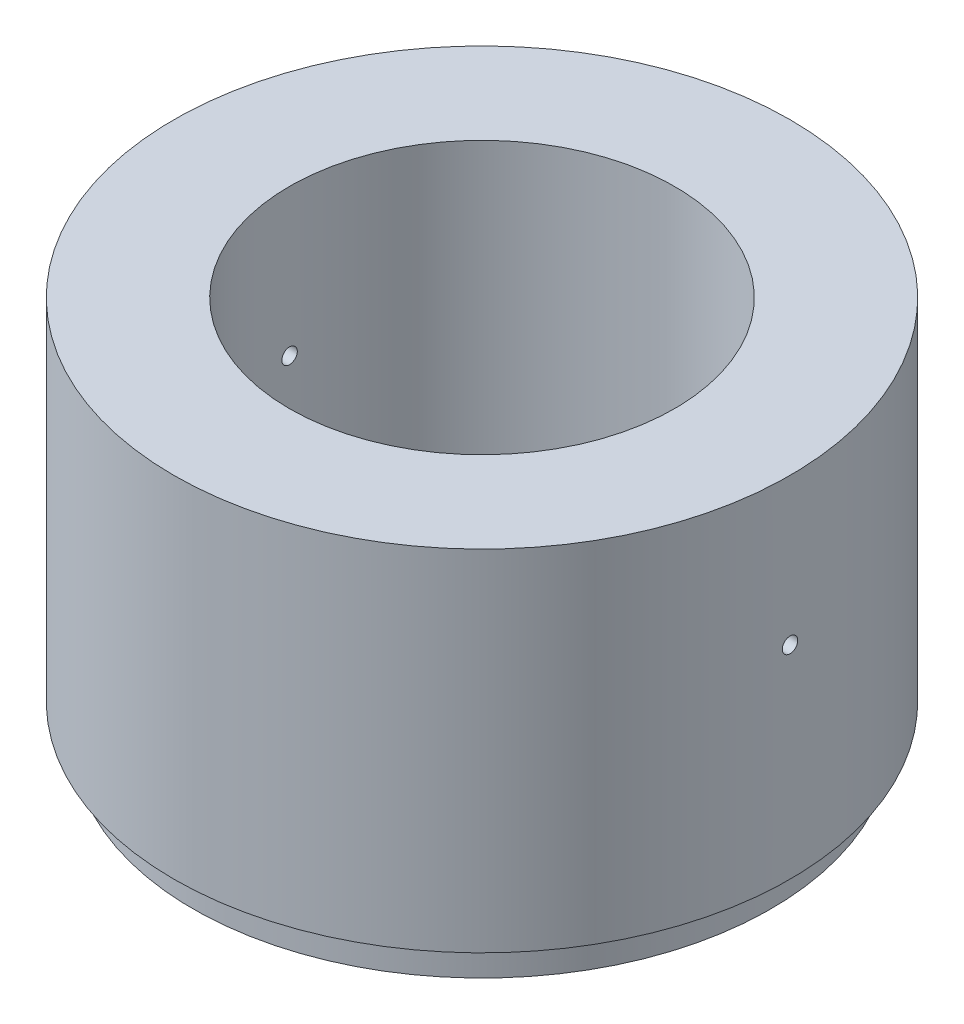
from build123d import *

# Parameters (mm, degrees)
SKETCH1_R               = 40
SKETCH1_R_2             = 25
BOSS_EXTRUDE1_DEPTH     = 50
SKETCH2_R               = 40
SKETCH2_R_2             = 37.5
CUT_EXTRUDE1_DEPTH      = 4.6
CUT_EXTRUDE2_DEPTH      = 76.498344353
CUT_EXTRUDE2_DEPTH_BACK = 76.498344353
SKETCH3_R               = 1


with BuildPart() as part:
    # Sketch1 → Boss-Extrude1 (new body)
    with BuildSketch(Plane(origin=(0, 0, 0), x_dir=(1, 0, 0), z_dir=(0, 1, 0))):
        Circle(SKETCH1_R)
        Circle(SKETCH1_R_2, mode=Mode.SUBTRACT)
    extrude(amount=BOSS_EXTRUDE1_DEPTH)

    # Sketch2 → Cut-Extrude1 (cut)
    with BuildSketch(Plane.XZ):
        Circle(SKETCH2_R)
        Circle(SKETCH2_R_2, mode=Mode.SUBTRACT)
    extrude(amount=-CUT_EXTRUDE1_DEPTH, mode=Mode.SUBTRACT)

    # Sketch3 → Cut-Extrude2 (cut, two sides: drawn at the far end of the back side and taken through both)
    with BuildSketch(Plane(origin=(0, 0, 0), x_dir=(0, 0, -1), z_dir=(1, 0, 0)).offset(-CUT_EXTRUDE2_DEPTH_BACK)):
        with Locations((0, 30.95)):
            Circle(SKETCH3_R)
    extrude(amount=CUT_EXTRUDE2_DEPTH + CUT_EXTRUDE2_DEPTH_BACK, mode=Mode.SUBTRACT)


solid = part.part
